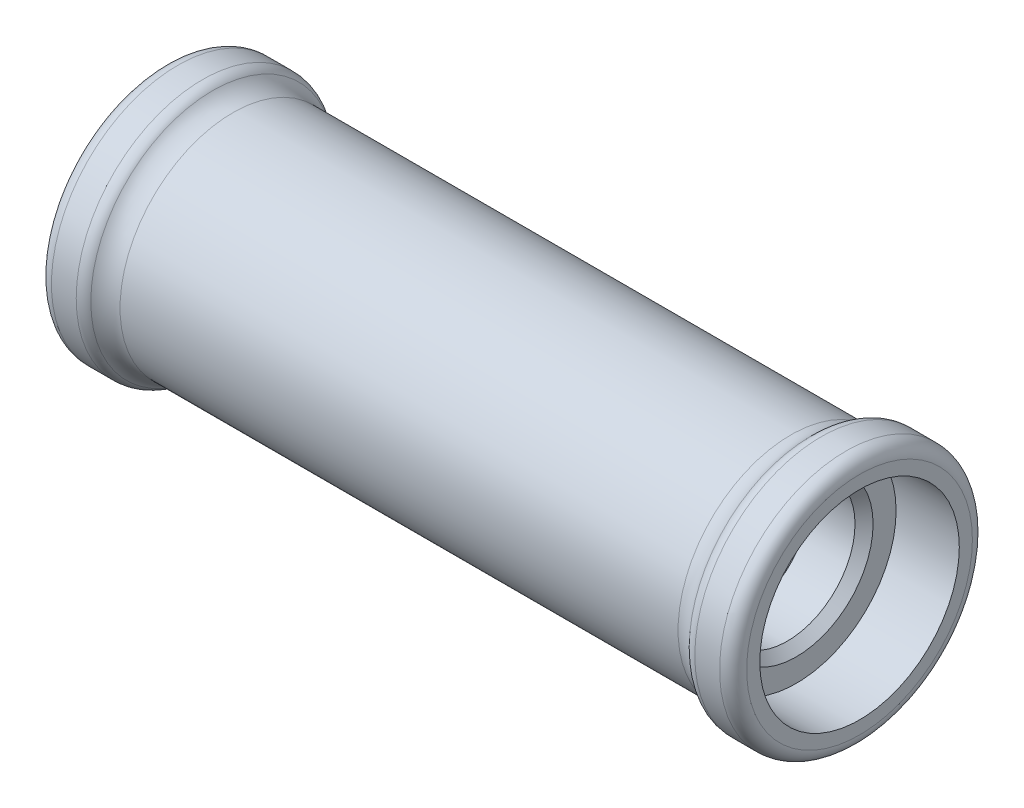
from build123d import *

# Parameters (mm, degrees)
SKETCH1_R               = 12.5
BOSS_EXTRUDE2_DEPTH     = 38.5
SKETCH3_R               = 14
BOSS_EXTRUDE3_DEPTH     = 5
CUT_EXTRUDE1_DEPTH      = 44.292609069
CUT_EXTRUDE1_DEPTH_BACK = 7
SKETCH4_R               = 11.05
SKETCH5_R               = 7.5
CUT_EXTRUDE2_DEPTH      = 7
FILLET2_R               = 3
FILLET3_R               = 1.5
CHAMFER1_SIZE           = 1


with BuildPart() as part:
    # Sketch1 → Boss-Extrude2 (new body)
    with BuildSketch(Plane(origin=(0, 0, 0), x_dir=(0, 0, -1), z_dir=(1, 0, 0))):
        Circle(SKETCH1_R)
    extrude(amount=BOSS_EXTRUDE2_DEPTH)

    # Sketch3 → Boss-Extrude3 (add)
    with BuildSketch(Plane(origin=(38.5, 0, 0), x_dir=(0, 0, -1), z_dir=(1, 0, 0))):
        Circle(SKETCH3_R)
    extrude(amount=-BOSS_EXTRUDE3_DEPTH)

    # Sketch4 → Cut-Extrude1 (cut, two sides: drawn at the far end of the back side and taken through both)
    with BuildSketch(Plane(origin=(38.5, 0, 0), x_dir=(0, 0, -1), z_dir=(1, 0, 0)).offset(-CUT_EXTRUDE1_DEPTH_BACK)):
        with Locations(Location((0, 0, 0), (0, 0, 180))):
            Circle(SKETCH4_R)
    extrude(amount=CUT_EXTRUDE1_DEPTH + CUT_EXTRUDE1_DEPTH_BACK, mode=Mode.SUBTRACT)

    # Sketch5 → Cut-Extrude2 (cut)
    with BuildSketch(Plane(origin=(31.5, 0, 0), x_dir=(0, 0, -1), z_dir=(1, 0, 0))):
        Circle(SKETCH5_R)
    extrude(amount=-CUT_EXTRUDE2_DEPTH, mode=Mode.SUBTRACT)

    # Fillet2
    # the kernel refuses this fillet: 3 mm, written as the material it adds along each edge
    with BuildSketch(Plane(origin=(33.5, 0, 0), x_dir=(0, 0, -1), z_dir=(0, 1, 0))) as fillet2_piece_1:
        with BuildLine():
            CenterArc((15.5, 2.598076211), FILLET2_R, 180, 60)
            Line((14, 0), (13.97, -0.051961524))
            ThreePointArc((13.97, -0.051961524), (13.25, -0.06), (12.5, -0.06))
            Line((12.5, -0.06), (12.44, 0))
            Line((12.44, 0), (12.44, 2.598076211))
            Line((12.44, 2.598076211), (12.5, 2.598076211))
        make_face()
    revolve(axis=Axis((33.5, 0, 0), (-1, 0, 0)))

    # Fillet3
    fillet3_edges = [part.edges().sort_by_distance(p)[0] for p in [
        (33.5, 0, 14),
        (38.5, 0, 14),
    ]]
    fillet(fillet3_edges, radius=FILLET3_R)

    # Mirror1: part across plane


with BuildPart() as part_1:
    add(part.part)
    add(part.part.mirror(Plane(origin=(0, 0, 0), x_dir=(0, 0, 1), z_dir=(1, 0, 0))))

    # Chamfer1
    chamfer1_edges = [part_1.edges().sort_by_distance(p)[0] for p in [
        (24.5, 0, 7.5),
        (31.5, 0, 7.5),
    ]]
    chamfer(chamfer1_edges, length=CHAMFER1_SIZE)


solid = part_1.part
